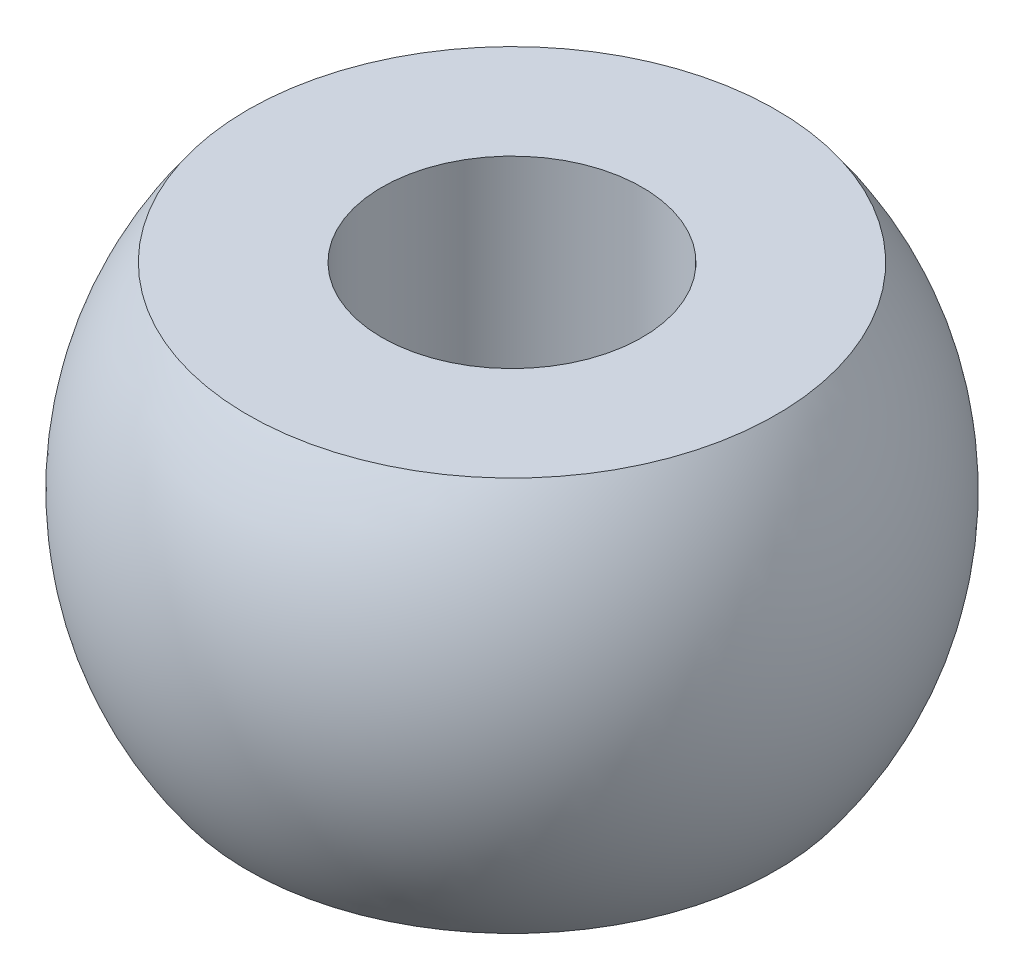
from build123d import *

# Parameters (mm, degrees)
SKETCH1_W           = 65
SKETCH1_H           = 5
BOSS_EXTRUDE1_DEPTH = 5
SKETCH3_R           = 1.65
CUT_EXTRUDE2_DEPTH  = 32.364560159


# Read off the part's stored shape, not the designer's step: Cut-Revolve1
with BuildPart() as part:
    # Sketch1 → Boss-Extrude1 (new, symmetric)
    with BuildSketch(Plane.XY):
        Rectangle(SKETCH1_W, SKETCH1_H)
    extrude(amount=BOSS_EXTRUDE1_DEPTH, both=True)

    # Cut-Revolve1 outline → Cut-Revolve1 (revolve, cut)
    with BuildSketch(Plane.YX):
        with BuildLine():
            Line((5.590169944, -32.5), (5.590169944, 32.5))
            Line((5.590169944, 32.5), (0, 32.5))
            Line((0, 32.5), (0, -22.319988038))
            ThreePointArc((0, -22.319988038), (4.180011962, -26.5), (0, -30.680011962))
            Line((0, -30.680011962), (0, -32.5))
            Line((0, -32.5), (5.590169944, -32.5))
        make_face()
    revolve(axis=Axis((0, 0, 0), (1, 0, 0)), mode=Mode.SUBTRACT)

    # Sketch3 → Cut-Extrude2 (cut, through all)
    with BuildSketch(Plane(origin=(0, 2.5, 0), x_dir=(1, 0, 0), z_dir=(0, 1, 0))):
        with Locations(Location((-26.5, 0, 0), (0, 0, 270))):
            Circle(SKETCH3_R)
    extrude(amount=-CUT_EXTRUDE2_DEPTH, mode=Mode.SUBTRACT)


solid = part.part
